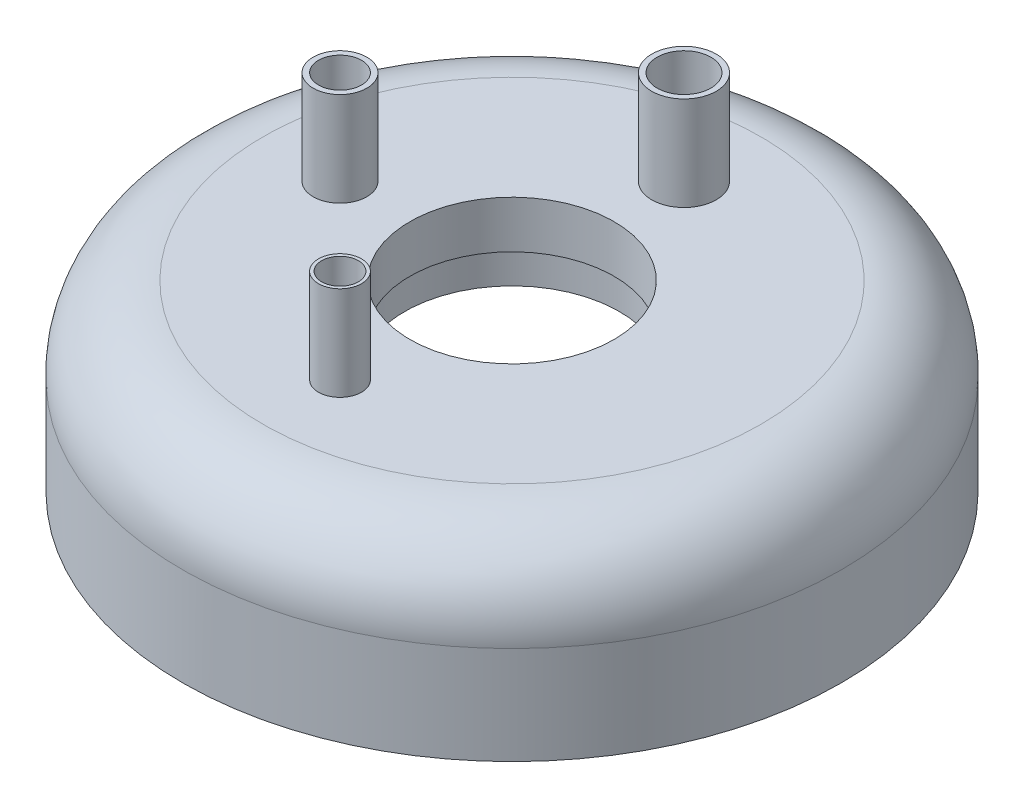
from build123d import *

# Parameters (mm, degrees)
THREAD1_PITCH       = 1.5
SKETCH2_R           = 6
SKETCH2_R_2         = 5
SKETCH2_R_3         = 4
SKETCH2_R_4         = 3.416264273
BOSS_EXTRUDE1_DEPTH = 17.5
CUT_EXTRUDE1_START  = -10
SKETCH3_R           = 5
SKETCH3_R_2         = 4
SKETCH3_R_3         = 3.45
CUT_EXTRUDE1_DEPTH  = 10
SKETCH4_W           = 2
SKETCH4_H           = 4.5
CUT_EXTRUDE2_DEPTH  = 87


with BuildPart() as part:
    # Sketch1 → Revolve1 (revolve)
    with BuildSketch(Plane.XY, mode=Mode.PRIVATE) as revolve1_sk:
        with BuildLine():
            Line((-19, 22.803702965), (-46.330642116, 22.803702965))
            ThreePointArc((-46.330642116, 22.803702965), (-57.270806365, 18.06590576), (-61.3, 6.845410458))
            Line((-61.3, 6.845410458), (-61.3, -11.36749479))
            Line((-61.3, -11.36749479), (-60, -11.36749479))
            Line((-60, -11.36749479), (-60, 6.93250521))
            Line((-60, 6.93250521), (-58.7, 6.93250521))
            ThreePointArc((-58.7, 6.93250521), (-55.401553099, 16.258203182), (-46.330642116, 20.203702965))
            Line((-46.330642116, 20.203702965), (-21, 20.203702965))
            Line((-21, 20.203702965), (-21, 7.803702965))
            Line((-21, 7.803702965), (-20, 7.803702965))
            Line((-20, 7.803702965), (-20, 14.003702965))
            Line((-20, 14.003702965), (-19, 14.003702965))
            Line((-19, 14.003702965), (-19, 22.803702965))
        make_face()
    revolve(revolve1_sk.sketch.rotate(Axis((0, -1000, 0), (0, 1, 0)), 180), axis=Axis((0, -1000, 0), (0, 1, 0)))

    # Thread1: the profile of Thread Profile1 profile screwed along a right-hand helix of 13.333333 turns, 8 arcs to a turn; built about Z, then put on its axis
    thread1_z = Axis((0, 0, 0), (0, 0, 1))
    thread1_corners = [(59.9997, 0, -0.000173205), (60.811898813, 0, 0.468749998), (60.811898813, 0, 0.656249998), (59.9997, 0, 1.125173201)]
    with BuildLine(mode=Mode.PRIVATE) as thread1_profile:
        Line(thread1_corners[0], thread1_corners[1])
        Line(thread1_corners[1], thread1_corners[2])
        Line(thread1_corners[2], thread1_corners[3])
        Line(thread1_corners[3], thread1_corners[0])
    thread1_cap = Face(thread1_profile.wire())
    thread1_turn_angles = [0, 22.5, 45, 67.5, 90, 112.5, 135, 157.5, 180, 202.5, 225, 247.5, 270, 292.5, 315, 337.5, 360]
    thread1_turn_weights = [1, 0.9238795325112867, 1, 0.9238795325112867, 1, 0.9238795325112867, 1, 0.9238795325112867, 1, 0.9238795325112867, 1, 0.9238795325112867, 1, 0.9238795325112867, 1, 0.9238795325112867, 1]
    thread1_turn_rails = [Edge.make_bspline([Vector(p[0], p[1], 0).rotate(thread1_z, thread1_turn_angles[k]) / thread1_turn_weights[k] + Vector(0, 0, p[2] + THREAD1_PITCH * thread1_turn_angles[k] / 360) for k in range(17)], [0, 0, 0, 1, 1, 2, 2, 3, 3, 4, 4, 5, 5, 6, 6, 7, 7, 8, 8, 8], 2, thread1_turn_weights) for p in thread1_corners]
    thread1_turn_sides = [Face.make_surface_from_curves(thread1_turn_rails[p[0]], thread1_turn_rails[p[1]]) for p in [(0, 1), (1, 2), (2, 3), (3, 0)]]
    thread1_last_angles = [4680, 4702.5, 4725, 4747.5, 4770, 4785, 4800]
    thread1_last_weights = [1, 0.9238795325112867, 1, 0.9238795325112867, 1, 0.9659258262890703, 1]
    thread1_last_rails = [Edge.make_bspline([Vector(p[0], p[1], 0).rotate(thread1_z, thread1_last_angles[k]) / thread1_last_weights[k] + Vector(0, 0, p[2] + THREAD1_PITCH * thread1_last_angles[k] / 360) for k in range(7)], [0, 0, 0, 1, 1, 2, 2, 3, 3, 3], 2, thread1_last_weights) for p in thread1_corners]
    thread1_last_sides = [Face.make_surface_from_curves(thread1_last_rails[p[0]], thread1_last_rails[p[1]]) for p in [(0, 1), (1, 2), (2, 3), (3, 0)]]
    thread1 = Plane(origin=(0, 6.93250521, 0), x_dir=(-1, 0, 0), z_dir=(0, -1, 0)) * Solid(Shell([*[p.moved(Location((0, 0, THREAD1_PITCH * i))) for i in range(13) for p in thread1_turn_sides], *thread1_last_sides, thread1_cap, thread1_cap.rotate(thread1_z, 4800).moved(Location((0, 0, THREAD1_PITCH * 4800 / 360)))]))
    add(thread1, mode=Mode.SUBTRACT)

    # Sketch2 → Boss-Extrude1 (add)
    # profile 1 of 3: a face of its own
    with BuildSketch(Plane(origin=(0, 22.803702965, 0), x_dir=(1, 0, 0), z_dir=(0, 1, 0))):
        with Locations((0, 32)):
            Circle(SKETCH2_R)
        with Locations(Location((0, 32, 0), (0, 0, 180))):
            Circle(SKETCH2_R_2, mode=Mode.SUBTRACT)
    # profile 2 of 3: a face of its own
    with BuildSketch(Plane(origin=(0, 22.803702965, 0), x_dir=(1, 0, 0), z_dir=(0, 1, 0))):
        with Locations((-32, 0)):
            Circle(SKETCH2_R_2)
        with Locations(Location((-32, 0, 0), (0, 0, 180))):
            Circle(SKETCH2_R_3, mode=Mode.SUBTRACT)
    # profile 3 of 3: a face of its own
    with BuildSketch(Plane(origin=(0, 22.803702965, 0), x_dir=(1, 0, 0), z_dir=(0, 1, 0))):
        with Locations((0, -32)):
            Circle(SKETCH2_R_3)
        with Locations(Location((0, -32, 0), (0, 0, 180))):
            Circle(SKETCH2_R_4, mode=Mode.SUBTRACT)
    extrude(amount=BOSS_EXTRUDE1_DEPTH)

    # Sketch3 → Cut-Extrude1 (cut)
    with BuildSketch(Plane(origin=(0, 22.803702965, 0), x_dir=(1, 0, 0), z_dir=(0, 1, 0)).offset(CUT_EXTRUDE1_START)):
        with Locations(Location((0, 32, 0), (0, 0, 180))):
            Circle(SKETCH3_R)
        with Locations(Location((-32, 0, 0), (0, 0, 180))):
            Circle(SKETCH3_R_2)
        with Locations(Location((0, -32, 0), (0, 0, 180))):
            Circle(SKETCH3_R_3)
    extrude(amount=CUT_EXTRUDE1_DEPTH, mode=Mode.SUBTRACT)

    # Sketch4 → Cut-Extrude2 (cut)
    with BuildSketch(Plane.XY):
        with Locations((0, -11.36749479)):
            Rectangle(SKETCH4_W, SKETCH4_H)
    extrude(amount=-CUT_EXTRUDE2_DEPTH, mode=Mode.SUBTRACT)


solid = part.part
